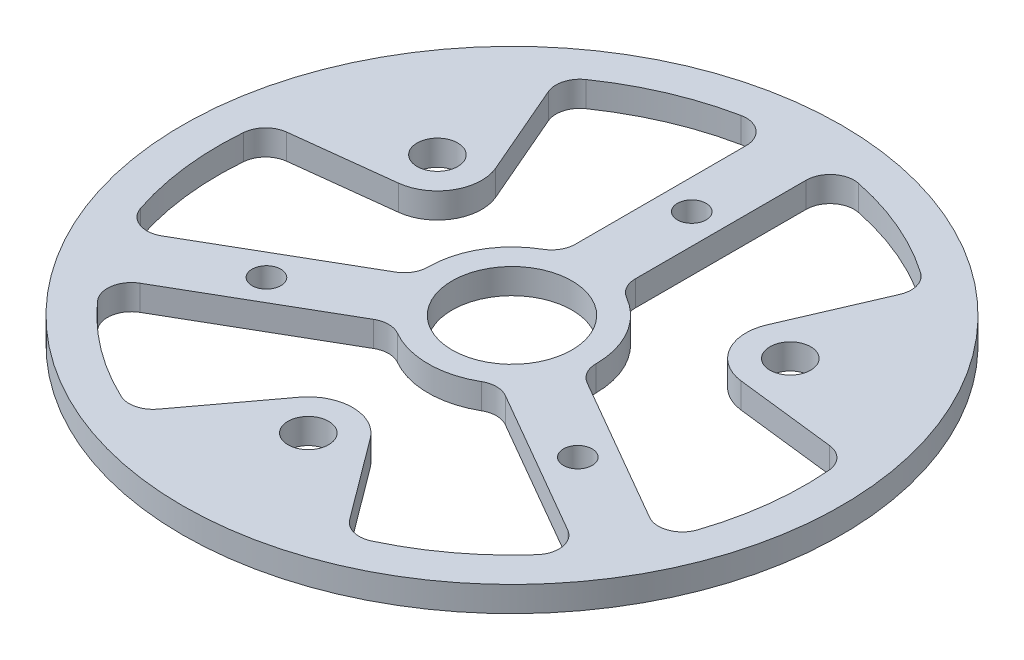
from build123d import *

# Parameters (mm, degrees)
CROQUIS1_R              = 27.5
SALIENTE_EXTRUIR1_DEPTH = 2.11
CROQUIS2_R              = 1.2
CROQUIS2_R_2            = 5
CROQUIS2_R_3            = 1.7
CORTAR_EXTRUIR1_DEPTH   = 39.948069272
REDONDEO1_R             = 2


with BuildPart() as part:
    # Croquis1 → Saliente-Extruir1 (new body)
    with BuildSketch(Plane(origin=(0, 0, 0), x_dir=(1, 0, 0), z_dir=(0, 1, 0))):
        Circle(CROQUIS1_R)
    extrude(amount=SALIENTE_EXTRUIR1_DEPTH)

    # Croquis2 → Cortar-Extruir1 (cut, through all)
    with BuildSketch(Plane(origin=(0, 2.11, 0), x_dir=(1, 0, 0), z_dir=(0, 1, 0))):
        with Locations((0, 15)):
            Circle(CROQUIS2_R)
        with Locations((12.990381057, -7.5)):
            Circle(CROQUIS2_R)
        with Locations((-12.990381057, -7.5)):
            Circle(CROQUIS2_R)
        Circle(CROQUIS2_R_2)
        with Locations((-14.722431864, 8.5)):
            Circle(CROQUIS2_R_3)
        with Locations((14.722431864, 8.5)):
            Circle(CROQUIS2_R_3)
        with Locations((0, -17)):
            Circle(CROQUIS2_R_3)
        with BuildLine():
            Line((-2.5, 6.538348415), (-2.5, 24.372115214))
            ThreePointArc((-2.5, 24.372115214), (-9.267968283, 22.679390731), (-15.28445201, 19.147729023))
            Line((-15.28445201, 19.147729023), (-11.324842647, 9.965055464))
            ThreePointArc((-11.324842647, 9.965055464), (-11.51813787, 6.65), (-14.292412506, 4.825073694))
            Line((-14.292412506, 4.825073694), (-24.224645764, 3.662859212))
            ThreePointArc((-24.224645764, 3.662859212), (-24.274912656, -3.313399391), (-22.356870919, -10.020994097))
            Line((-22.356870919, -10.020994097), (-6.912375826, -1.104110698))
            ThreePointArc((-6.912375826, -1.104110698), (-6.062177826, 3.5), (-2.5, 6.538348415))
        make_face()
        with BuildLine():
            Line((2.5, 6.538348415), (2.5, 24.372115214))
            ThreePointArc((2.5, 24.372115214), (9.267968283, 22.679390731), (15.28445201, 19.147729023))
            Line((15.28445201, 19.147729023), (11.324842647, 9.965055464))
            ThreePointArc((11.324842647, 9.965055464), (11.51813787, 6.65), (14.292412506, 4.825073694))
            Line((14.292412506, 4.825073694), (24.224645764, 3.662859212))
            ThreePointArc((24.224645764, 3.662859212), (24.274912656, -3.313399391), (22.356870919, -10.020994097))
            Line((22.356870919, -10.020994097), (6.912375826, -1.104110698))
            ThreePointArc((6.912375826, -1.104110698), (6.062177826, 3.5), (2.5, 6.538348415))
        make_face()
        with BuildLine():
            Line((4.412375826, -5.434237717), (19.856870919, -14.351121116))
            ThreePointArc((19.856870919, -14.351121116), (15.006944374, -19.36599134), (8.940193754, -22.810588235))
            Line((8.940193754, -22.810588235), (2.967569858, -14.790129159))
            ThreePointArc((2.967569858, -14.790129159), (0, -13.3), (-2.967569858, -14.790129159))
            Line((-2.967569858, -14.790129159), (-8.940193754, -22.810588235))
            ThreePointArc((-8.940193754, -22.810588235), (-15.006944374, -19.36599134), (-19.856870919, -14.351121116))
            Line((-19.856870919, -14.351121116), (-4.412375826, -5.434237717))
            ThreePointArc((-4.412375826, -5.434237717), (0, -7), (4.412375826, -5.434237717))
        make_face()
    extrude(amount=-CORTAR_EXTRUIR1_DEPTH, mode=Mode.SUBTRACT)

    # Redondeo1
    redondeo1_edges = [part.edges().sort_by_distance(p)[0] for p in [
        (-4.412375826, 1.055, 5.434237717),
        (4.412375826, 1.055, 5.434237717),
        (6.912375826, 1.055, 1.104110698),
        (2.5, 1.055, -6.538348415),
        (-6.912375826, 1.055, 1.104110698),
        (-2.5, 1.055, -6.538348415),
        (-19.856870919, 1.055, 14.351121116),
        (22.356870919, 1.055, 10.020994097),
        (-2.5, 1.055, -24.372115214),
        (15.28445201, 1.055, -19.147729023),
        (24.224645764, 1.055, -3.662859212),
        (-15.28445201, 1.055, -19.147729023),
        (-24.224645764, 1.055, -3.662859212),
        (-22.356870919, 1.055, 10.020994097),
        (19.856870919, 1.055, 14.351121116),
        (-8.940193754, 1.055, 22.810588235),
        (8.940193754, 1.055, 22.810588235),
        (2.5, 1.055, -24.372115214),
    ]]
    fillet(redondeo1_edges, radius=REDONDEO1_R)


solid = part.part
